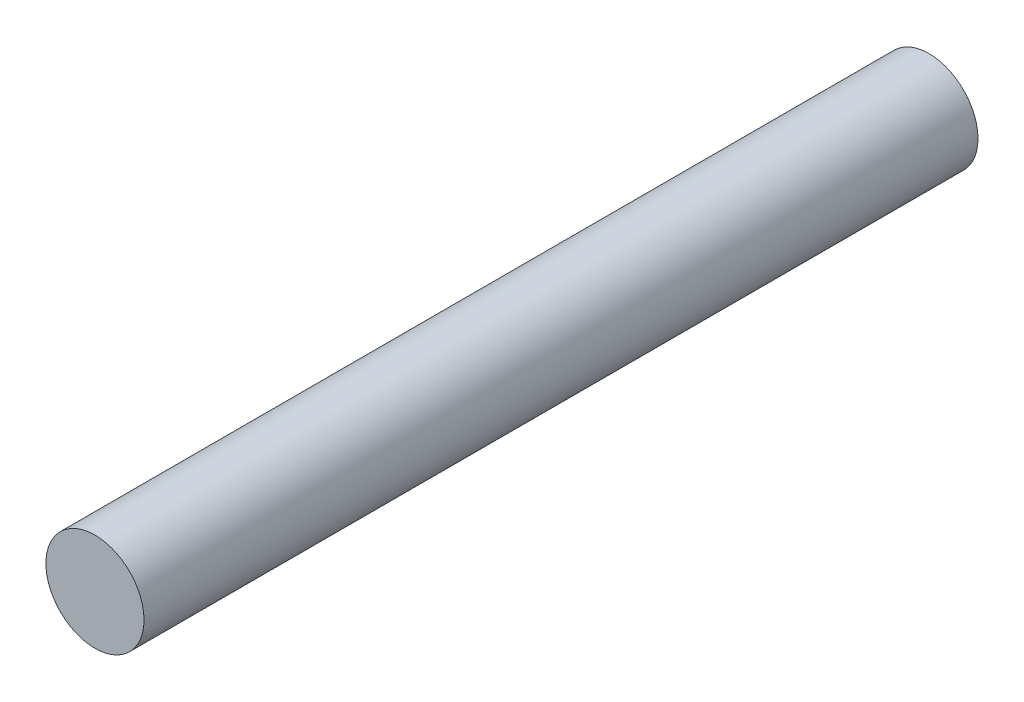
from build123d import *

# Parameters (mm, degrees)
SKETCH1_R           = 3.175
BOSS_EXTRUDE1_DEPTH = 53.975


with BuildPart() as part:
    # Sketch1 → Boss-Extrude1 (new body)
    with BuildSketch(Plane.XY):
        Circle(SKETCH1_R)
    extrude(amount=BOSS_EXTRUDE1_DEPTH)


solid = part.part
